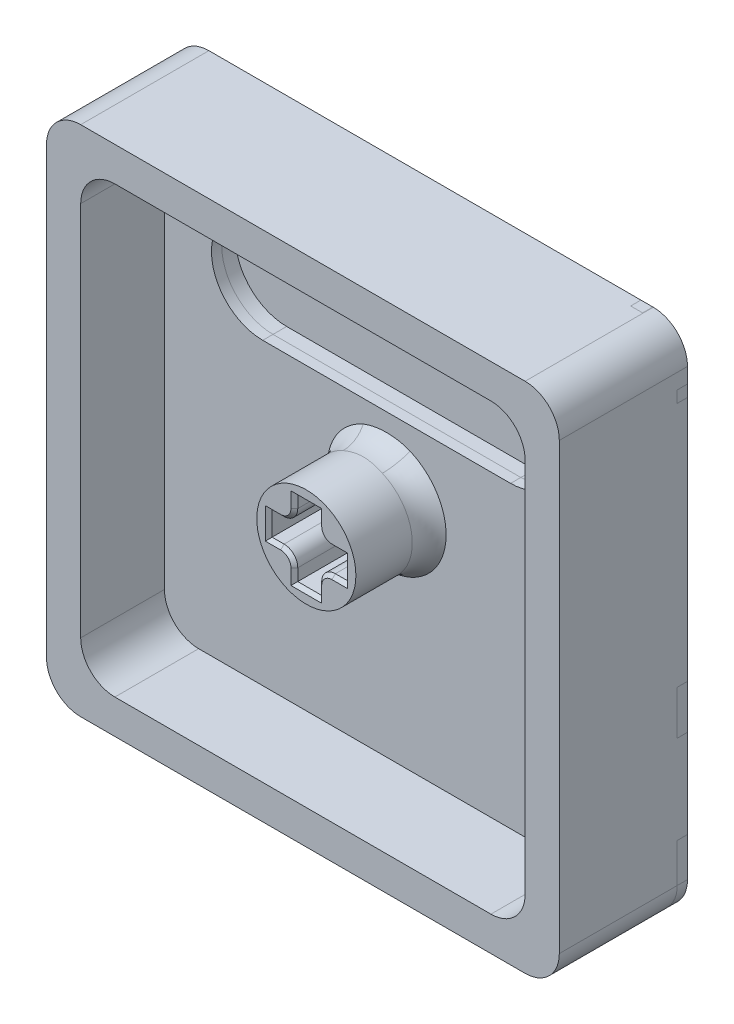
from build123d import *

# Parameters (mm, degrees)
EXTRUDE_1_DEPTH     = 5.5
SKETCH_1_6_R        = 2.9
EXTRUDE_2_DEPTH     = 5.3
EXTRUDE_START       = -2
EXTRUDE_3_DEPTH     = 2
EXTRUDE_4_DEPTH     = 2
CUT_EXTRUDE_1_REACH = 23.915
EXTRUDE_6_DEPTH     = 1.2
SKETCH_7_R          = 2.9
EXTRUDE_7_DEPTH     = 0.6
FILLET_4_R          = 0.8
CHAMFER_1_SIZE      = 0.2
FILLET_5_R          = 2
CUT_EXTRUDE_3_DEPTH = 0.6
EXTRUDE_START_2     = -0.6
EXTRUDE_8_DEPTH     = 0.6


# Read off the part's stored shape, not the designer's step: 凸台-拉伸8
with BuildPart() as part:
    # 草图1 → 凸台-拉伸1 (new body)
    with BuildSketch(Plane.XY):
        with BuildLine():
            ThreePointArc((-15, 13), (-14.414213562, 14.414213562), (-13, 15))
            Line((-13, 15), (13, 15))
            ThreePointArc((13, 15), (14.414213562, 14.414213562), (15, 13))
            Line((15, 13), (15, -13))
            ThreePointArc((15, -13), (14.414213562, -14.414213562), (13, -15))
            Line((13, -15), (-13, -15))
            ThreePointArc((-13, -15), (-14.414213562, -14.414213562), (-15, -13))
            Line((-15, -13), (-15, 13))
        make_face()
        with BuildLine():
            ThreePointArc((-13, -11), (-12.414213562, -12.414213562), (-11, -13))
            Line((-11, -13), (11, -13))
            ThreePointArc((11, -13), (12.414213562, -12.414213562), (13, -11))
            Line((13, -11), (13, 11))
            ThreePointArc((13, 11), (12.414213562, 12.414213562), (11, 13))
            Line((11, 13), (-11, 13))
            ThreePointArc((-11, 13), (-12.414213562, 12.414213562), (-13, 11))
            Line((-13, 11), (-13, -11))
        make_face(mode=Mode.SUBTRACT)
    extrude(amount=EXTRUDE_1_DEPTH)



with BuildPart() as body_2:
    # 草图1<6> → 凸台-拉伸2 (new body)
    with BuildSketch(Plane.XY):
        Circle(SKETCH_1_6_R)
        Polygon((-2.2, -0.7), (-2.2, 0.7), (-0.7, 0.7), (-0.7, 2.2), (0.7, 2.2), (0.7, 0.7), (2.2, 0.7), (2.2, -0.7), (0.7, -0.7), (0.7, -2.2), (-0.7, -2.2), (-0.7, -0.7), align=None, mode=Mode.SUBTRACT)
    extrude(amount=EXTRUDE_2_DEPTH)


with BuildPart() as part_1:
    add(part.part)

    add(body_2.part)  # 凸台-拉伸3 merges body 2
    # 草图1<7> → 凸台-拉伸3 (add)
    with BuildSketch(Plane.XY.offset(EXTRUDE_START)):
        with BuildLine():
            Line((-13, 15), (13, 15))
            ThreePointArc((13, 15), (14.414213562, 14.414213562), (15, 13))
            Line((15, 13), (15, -13))
            ThreePointArc((15, -13), (14.414213562, -14.414213562), (13, -15))
            Line((13, -15), (-13, -15))
            ThreePointArc((-13, -15), (-14.414213562, -14.414213562), (-15, -13))
            Line((-15, -13), (-15, 13))
            ThreePointArc((-15, 13), (-14.414213562, 14.414213562), (-13, 15))
        make_face()
    extrude(amount=EXTRUDE_3_DEPTH)

    # 草图3 → 凸台-拉伸4 (add)
    with BuildSketch(Plane.XY):
        Polygon((0.7, 0.7), (0.7, 2.2), (-0.7, 2.2), (-0.7, 0.7), (-2.2, 0.7), (-2.2, -0.7), (-0.7, -0.7), (-0.7, -2.2), (0.7, -2.2), (0.7, -0.7), (2.2, -0.7), (2.2, 0.7), align=None)
    extrude(amount=EXTRUDE_4_DEPTH)

    # 草图5 → 切除-拉伸1 (cut, up to next)
    with BuildSketch(Plane.XY, mode=Mode.PRIVATE) as cut_extrude_1_sk1:
        with BuildLine():
            Line((7.25, 4.5), (-7.25, 4.5))
            ThreePointArc((-7.25, 4.5), (-10.25, 7.5), (-7.25, 10.5))
            Line((-7.25, 10.5), (7.25, 10.5))
            ThreePointArc((7.25, 10.5), (10.25, 7.5), (7.25, 4.5))
        make_face()
    cut_extrude_1_tool1 = extrude(cut_extrude_1_sk1.sketch, amount=-CUT_EXTRUDE_1_REACH, mode=Mode.PRIVATE) & part_1.part
    add(cut_extrude_1_tool1.solids().sort_by_distance((0, 7.5, 0))[0], mode=Mode.SUBTRACT)

    # 圆角4
    fillet_4_edges = [part_1.edges().sort_by_distance(p)[0] for p in [
        (0.7, 0.7, 3.65),
        (0.7, -0.7, 3.65),
        (-0.7, -0.7, 3.65),
        (-0.7, 0.7, 3.65),
    ]]
    fillet(fillet_4_edges, radius=FILLET_4_R)

    # 倒角1
    chamfer_1_edges = [part_1.edges().sort_by_distance(p)[0] for p in [
        (1.85, 0.7, 5.3),
        (1.85, -0.7, 5.3),
        (0.7, -1.85, 5.3),
        (-0.7, -1.85, 5.3),
        (0.934314575, -0.934314575, 5.3),
        (-0.934314575, -0.934314575, 5.3),
        (0.934314575, 0.934314575, 5.3),
        (-0.934314575, 0.934314575, 5.3),
        (0, -2.2, 5.3),
        (-1.85, -0.7, 5.3),
        (-2.2, 0, 5.3),
        (-0.7, 1.85, 5.3),
        (0, 2.2, 5.3),
        (0.7, 1.85, 5.3),
        (2.2, 0, 5.3),
        (-1.85, 0.7, 5.3),
    ]]
    chamfer(chamfer_1_edges, length=CHAMFER_1_SIZE)

    # 圆角5
    fillet_5_edges = [part_1.edges().sort_by_distance(p)[0] for p in [
        (-2.9, 0, 0),
    ]]
    fillet(fillet_5_edges, radius=FILLET_5_R)

    # 草图8 → 切除-拉伸3 (cut)
    with BuildSketch(Plane(origin=(0, 0, -2), x_dir=(-1, 0, 0), z_dir=(0, 0, -1))):
        Polygon((-15.546395055, -5.703745737), (-14.869473167, -2.298875466), (-12.679764908, -4.824355414), align=None)
        Polygon((-7.160662898, -7.504670408), (-10.402182786, -6.933650274), (-11.247356483, -9.441891564), align=None)
        with BuildLine():
            Line((-13.525244561, -9.695902099), (-15, -10.71525213))
            Line((-15, -10.71525213), (-15, -13))
            ThreePointArc((-15, -13), (-14.414213562, -14.414213562), (-13, -15))
            Line((-13, -15), (-11.766710512, -15))
            Line((-11.766710512, -15), (-13.525244561, -9.695902099))
        make_face()
        Polygon((-9.98116902, -13.08507657), (-7.92630334, -15), (-6.154109719, -15), (-4.076742159, -12.375272731), align=None)
        Polygon((-4.511536199, -8.97704997), (-1.324069626, -10.493670314), (-2.678406497, -6.599709887), align=None)
        Polygon((3.426889777, -12.096760264), (0.793821802, -15), (2.345007298, -15), align=None)
        Polygon((3.597028602, -8.986699207), (5.981823472, -7.81619336), (3.941783771, -5.98021708), align=None)
        Polygon((5.918699203, -11.646077721), (7.981024545, -12.096760264), (7.248291621, -10.34043735), align=None)
        Polygon((8.961531272, -14.019493273), (7.981024545, -15), (9.584200735, -15), align=None)
        Polygon((9.308861768, -11.090900294), (11.456694359, -13.083381319), (12.693002058, -10.71525213), align=None)
        Polygon((9.427305026, -8.229895047), (11.408971388, -5.283782593), (8.723787605, -5.283782593), align=None)
        Polygon((12.489924815, -3.728504993), (15.454411648, -2.223746843), (14.079541142, -0.248895716), align=None)
        Polygon((0.793821802, -12.812411829), (0.793821802, -8.616294715), (2.955012052, -7.504670408), align=None)
        Polygon((-8.526408041, -9.999432692), (-5.969124345, -10.493670314), (-6.762406296, -11.522457845), align=None)
        Polygon((-13.114049005, 4.922944628), (-11.045900554, 3.99549411), (-12.05182769, 7.246068526), align=None)
        Polygon((-8.130692105, 11.45840297), (-11.597094434, 10.444382576), (-9.692242888, 12.658758491), align=None)
        Polygon((-15, 12.110209887), (-15, 11.4270237), (-12.05182769, 11.944639707), (-12.275011661, 15), (-12.973391064, 15), align=None)
        Polygon((9.584200735, 11.692623639), (12.119077777, 12.208787919), (10.835642066, 13.616493729), align=None)
        Polygon((13.071282126, 9.860178303), (13.591882558, 12.658758491), (14.079541142, 10.444382576), align=None)
    extrude(amount=-CUT_EXTRUDE_3_DEPTH, mode=Mode.SUBTRACT)


with BuildPart() as body_2_2:
    # 草图6 → 凸台-拉伸6 (new body)
    with BuildSketch(Plane(origin=(0, 0, -2), x_dir=(-1, 0, 0), z_dir=(0, 0, -1))):
        with BuildLine():
            Line((7.25, 4.5), (-7.25, 4.5))
            ThreePointArc((-7.25, 4.5), (-10.25, 7.5), (-7.25, 10.5))
            Line((-7.25, 10.5), (7.25, 10.5))
            ThreePointArc((7.25, 10.5), (10.25, 7.5), (7.25, 4.5))
        make_face()
    extrude(amount=-EXTRUDE_6_DEPTH)


with BuildPart() as body_3:
    # 草图7 → 凸台-拉伸7 (new body)
    with BuildSketch(Plane.XY):
        with BuildLine():
            Line((-13, 11), (-13, -11))
            ThreePointArc((-13, -11), (-12.414213562, -12.414213562), (-11, -13))
            Line((-11, -13), (11, -13))
            ThreePointArc((11, -13), (12.414213562, -12.414213562), (13, -11))
            Line((13, -11), (13, 11))
            ThreePointArc((13, 11), (12.414213562, 12.414213562), (11, 13))
            Line((11, 13), (-11, 13))
            ThreePointArc((-11, 13), (-12.414213562, 12.414213562), (-13, 11))
        make_face()
        Circle(SKETCH_7_R, mode=Mode.SUBTRACT)
        with BuildLine():
            Line((7.25, 4.5), (-7.25, 4.5))
            ThreePointArc((-7.25, 4.5), (-10.25, 7.5), (-7.25, 10.5))
            Line((-7.25, 10.5), (7.25, 10.5))
            ThreePointArc((7.25, 10.5), (10.25, 7.5), (7.25, 4.5))
        make_face(mode=Mode.SUBTRACT)
    extrude(amount=EXTRUDE_7_DEPTH)


with BuildPart() as body_4:
    # 凸台-拉伸8 outline → 凸台-拉伸8 (new body)
    with BuildSketch(Plane(origin=(0, 0, -2), x_dir=(-1, 0, 0), z_dir=(0, 0, -1)).offset(EXTRUDE_START_2)):
        Polygon((-8.526408041, -9.999432692), (-6.762406296, -11.522457845), (-5.969124345, -10.493670314), align=None)
        Polygon((13.591882558, 12.658758491), (13.071282126, 9.860178303), (14.079541142, 10.444382576), align=None)
        Polygon((10.835642066, 13.616493729), (9.584200735, 11.692623639), (12.119077777, 12.208787919), align=None)
        Polygon((-12.05182769, 7.246068526), (-13.114049005, 4.922944628), (-11.045900554, 3.99549411), align=None)
        Polygon((-11.597094434, 10.444382576), (-8.130692105, 11.45840297), (-9.692242888, 12.658758491), align=None)
        Polygon((-15, 12.110209887), (-15, 11.4270237), (-12.05182769, 11.944639707), (-12.275011661, 15), (-12.973391064, 15), align=None)
        Polygon((-14.869473167, -2.298875466), (-15, -2.955416409), (-15, -5.536129233), (-12.679764908, -4.824355414), align=None)
        with BuildLine():
            Line((-13.525244561, -9.695902099), (-15, -10.71525213))
            Line((-15, -10.71525213), (-15, -13))
            ThreePointArc((-15, -13), (-14.414213562, -14.414213562), (-13, -15))
            Line((-13, -15), (-11.766710512, -15))
            Line((-11.766710512, -15), (-13.525244561, -9.695902099))
        make_face()
        Polygon((0.793821802, -8.616294715), (0.793821802, -12.812411829), (2.955012052, -7.504670408), align=None)
        Polygon((12.489924815, -3.728504993), (15, -2.45440384), (15, -1.571034205), (14.079541142, -0.248895716), align=None)
        Polygon((8.723787605, -5.283782593), (9.427305026, -8.229895047), (11.408971388, -5.283782593), align=None)
        Polygon((12.693002058, -10.71525213), (9.308861768, -11.090900294), (11.456694359, -13.083381319), align=None)
        Polygon((9.584200735, -15), (8.961531272, -14.019493273), (7.981024545, -15), align=None)
        Polygon((3.426889777, -12.096760264), (0.793821802, -15), (2.345007298, -15), align=None)
        Polygon((-9.98116902, -13.08507657), (-7.92630334, -15), (-6.154109719, -15), (-4.076742159, -12.375272731), align=None)
        Polygon((7.248291621, -10.34043735), (5.918699203, -11.646077721), (7.981024545, -12.096760264), align=None)
        Polygon((3.941783771, -5.98021708), (3.597028602, -8.986699207), (5.981823472, -7.81619336), align=None)
        Polygon((-2.678406497, -6.599709887), (-4.511536199, -8.97704997), (-1.324069626, -10.493670314), align=None)
        Polygon((-11.247356483, -9.441891564), (-7.160662898, -7.504670408), (-10.402182786, -6.933650274), align=None)
    extrude(amount=EXTRUDE_8_DEPTH)


solid = Compound([part_1.part, body_2_2.part, body_3.part, body_4.part])
